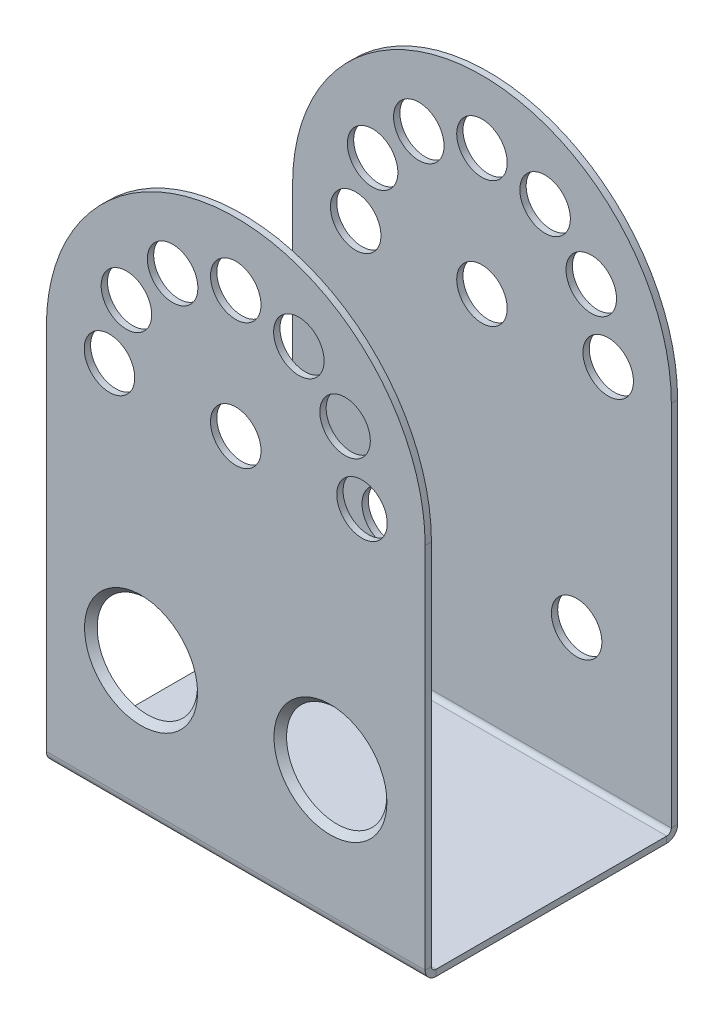
from build123d import *

# Parameters (mm, degrees)
CROQUIS1_W                       = 60
CROQUIS1_H                       = 40
BRIDA_BASE2_DEPTH                = 1
BRIDA_DE_ARISTA1_STRIP_W         = 5.4732
BRIDA_DE_ARISTA1_STRIP_H         = 1
BRIDA_DE_ARISTA1_STRIP_CUT_DEPTH = 60
BRIDA_DE_ARISTA1_DEPTH           = 60
BRIDA_DE_ARISTA2_STRIP_W         = 5.4732
BRIDA_DE_ARISTA2_STRIP_H         = 1
BRIDA_DE_ARISTA2_STRIP_CUT_DEPTH = 60
BRIDA_DE_ARISTA2_DEPTH           = 60
CROQUIS17_R                      = 4
CORTAR_EXTRUIR1_DEPTH            = 50
CROQUIS18_R                      = 4
CORTAR_EXTRUIR2_DEPTH            = 10
CROQUIS19_R                      = 8.95
CORTAR_EXTRUIR3_DEPTH            = 1
CORTAR_EXTRUIR3_DRAFT            = -45
CORTAR_EXTRUIR3_PROFILE_2_DEPTH  = 1
CORTAR_EXTRUIR3_PROFILE_2_DRAFT  = -45


# Sheet-metal steps are written as plain solids
with BuildPart() as part:
    # Croquis1 → Brida base2 (new body)
    with BuildSketch(Plane(origin=(0, 0, 0), x_dir=(1, 0, 0), z_dir=(0, 1, 0))):
        Rectangle(CROQUIS1_W, CROQUIS1_H)
    extrude(amount=-BRIDA_BASE2_DEPTH)

    # Brida de arista1 strip (across the edge) → Brida de arista1 strip cut (cut)
    with BuildSketch(Plane(origin=(-30, 0, 20), x_dir=(0, 0, -1), z_dir=(1, 0, 0))):
        with Locations((-1, -0.5)):
            Rectangle(BRIDA_DE_ARISTA1_STRIP_W, BRIDA_DE_ARISTA1_STRIP_H)
    extrude(amount=BRIDA_DE_ARISTA1_STRIP_CUT_DEPTH, mode=Mode.SUBTRACT)

    # Brida de arista1 section (across the edge) → Brida de arista1 (add)
    with BuildSketch(Plane(origin=(-30, 0, 20), x_dir=(0, 0, -1), z_dir=(1, 0, 0))):
        with BuildLine():
            Line((0, 0.7366), (0, 89))
            Line((0, 89), (1, 89))
            Line((1, 89), (1, 0.7366))
            ThreePointArc((1, 0.7366), (1.215745145, 0.215745145), (1.7366, 0))
            Line((1.7366, 0), (1.7366, -1))
            ThreePointArc((1.7366, -1), (0.508638364, -0.491361636), (0, 0.7366))
        make_face()
    extrude(amount=BRIDA_DE_ARISTA1_DEPTH)

    # Brida de arista2 strip (across the edge) → Brida de arista2 strip cut (cut)
    with BuildSketch(Plane(origin=(30, 0, -20), x_dir=(0, 0, 1), z_dir=(-1, 0, 0))):
        with Locations((-1, -0.5)):
            Rectangle(BRIDA_DE_ARISTA2_STRIP_W, BRIDA_DE_ARISTA2_STRIP_H)
    extrude(amount=BRIDA_DE_ARISTA2_STRIP_CUT_DEPTH, mode=Mode.SUBTRACT)

    # Brida de arista2 section (across the edge) → Brida de arista2 (add)
    with BuildSketch(Plane(origin=(30, 0, -20), x_dir=(0, 0, 1), z_dir=(-1, 0, 0))):
        with BuildLine():
            Line((0, 0.7366), (0, 89))
            Line((0, 89), (1, 89))
            Line((1, 89), (1, 0.7366))
            ThreePointArc((1, 0.7366), (1.215745145, 0.215745145), (1.7366, 0))
            Line((1.7366, 0), (1.7366, -1))
            ThreePointArc((1.7366, -1), (0.508638364, -0.491361636), (0, 0.7366))
        make_face()
    extrude(amount=BRIDA_DE_ARISTA2_DEPTH)

    # Croquis17 → Cortar-Extruir1 (cut)
    with BuildSketch(Plane.XY.offset(20)):
        with BuildLine():
            ThreePointArc((-7.5e-08, 89), (21.213203409, 80.213203462), (30, 59))
            Line((30, 59), (30, 89))
            Line((30, 89), (-7.5e-08, 89))
        make_face()
        with BuildLine():
            ThreePointArc((-30, 59), (-21.213203462, 80.213203409), (-7.5e-08, 89))
            Line((-7.5e-08, 89), (-30, 89))
            Line((-30, 89), (-30, 59))
        make_face()
        with Locations(Location((0, 59, 0), (0, 0, 180))):
            Circle(CROQUIS17_R)
        with Locations(Location((20, 59, 0), (0, 0, 180))):
            Circle(CROQUIS17_R)
        with Locations(Location((10, 76.320508076, 0), (0, 0, 180))):
            Circle(CROQUIS17_R)
        with Locations(Location((17.320508076, 69, 0), (0, 0, 180))):
            Circle(CROQUIS17_R)
        with Locations(Location((0, 79, 0), (0, 0, 180))):
            Circle(CROQUIS17_R)
        with Locations(Location((-10, 76.320508076, 0), (0, 0, 180))):
            Circle(CROQUIS17_R)
        with Locations(Location((-17.320508076, 69, 0), (0, 0, 180))):
            Circle(CROQUIS17_R)
        with Locations(Location((-20, 59, 0), (0, 0, 180))):
            Circle(CROQUIS17_R)
    extrude(amount=-CORTAR_EXTRUIR1_DEPTH, mode=Mode.SUBTRACT)

    # Croquis18 → Cortar-Extruir2 (cut)
    with BuildSketch(Plane(origin=(0, 0, -20), x_dir=(-1, 0, 0), z_dir=(0, 0, -1))):
        with Locations((-15, 20.7366)):
            Circle(CROQUIS18_R)
        with Locations((15, 20.7366)):
            Circle(CROQUIS18_R)
    extrude(amount=-CORTAR_EXTRUIR2_DEPTH, mode=Mode.SUBTRACT)


with BuildPart() as cortar_extruir3_tool:
    # Croquis19 → Cortar-Extruir3 (with draft: the straight prism first)
    with BuildSketch(Plane.XY.offset(20)):
        with Locations((-15, 20.7366)):
            Circle(CROQUIS19_R)
    extrude(amount=-CORTAR_EXTRUIR3_DEPTH)
    # Cortar-Extruir3: the draft: its side faces are tilted about the plane it starts from
    cortar_extruir3_sides = [cortar_extruir3_tool.faces().sort_by_distance(p)[0] for p in [
        (-23.95, 20.7366, 19.5),
    ]]
    draft(cortar_extruir3_sides, Plane.XY.offset(20), CORTAR_EXTRUIR3_DRAFT)


with BuildPart() as part_1:
    add(part.part)

    # Cortar-Extruir3: cut by cortar_extruir3_tool
    add(cortar_extruir3_tool.part, mode=Mode.SUBTRACT)


with BuildPart() as cortar_extruir3_profile_2_tool:
    # Croquis19 → Cortar-Extruir3 profile 2 (with draft: the straight prism first)
    with BuildSketch(Plane.XY.offset(20)):
        with Locations((15, 20.7366)):
            Circle(CROQUIS19_R)
    extrude(amount=-CORTAR_EXTRUIR3_PROFILE_2_DEPTH)
    # Cortar-Extruir3 profile 2: the draft: its side faces are tilted about the plane it starts from
    cortar_extruir3_profile_2_sides = [cortar_extruir3_profile_2_tool.faces().sort_by_distance(p)[0] for p in [
        (6.05, 20.7366, 19.5),
    ]]
    draft(cortar_extruir3_profile_2_sides, Plane.XY.offset(20), CORTAR_EXTRUIR3_PROFILE_2_DRAFT)


with BuildPart() as part_2:
    add(part_1.part)

    # Cortar-Extruir3 profile 2: cut by cortar_extruir3_profile_2_tool
    add(cortar_extruir3_profile_2_tool.part, mode=Mode.SUBTRACT)


solid = part_2.part
